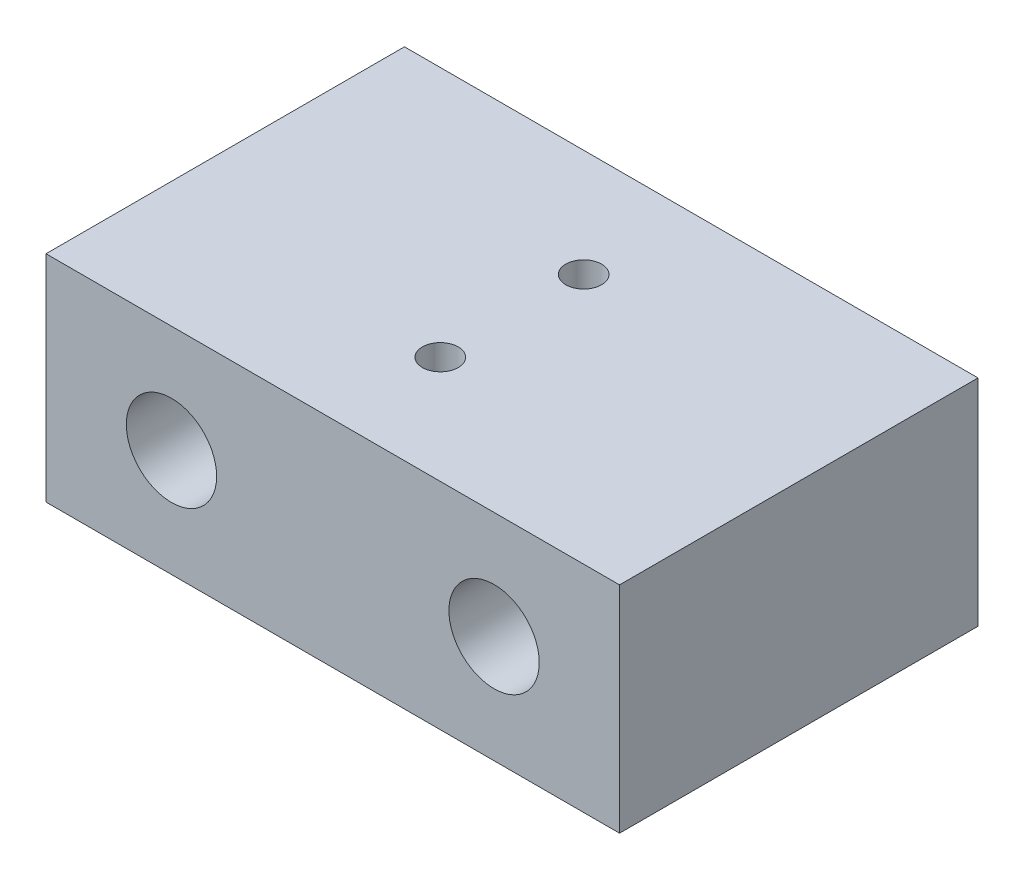
from build123d import *

# Parameters (mm, degrees)
SKETCH1_W           = 50.8
SKETCH1_H           = 19.05
SKETCH1_R           = 4
BOSS_EXTRUDE1_DEPTH = 31.75
SKETCH2_R           = 1.5875
CUT_EXTRUDE1_DEPTH  = 45.901280605


with BuildPart() as part:
    # Sketch1 → Boss-Extrude1 (new body)
    with BuildSketch(Plane.XY):
        Rectangle(SKETCH1_W, SKETCH1_H)
        with Locations((-14.2875, 0)):
            Circle(SKETCH1_R, mode=Mode.SUBTRACT)
        with Locations((14.2875, 0)):
            Circle(SKETCH1_R, mode=Mode.SUBTRACT)
    extrude(amount=BOSS_EXTRUDE1_DEPTH)

    # Sketch2 → Cut-Extrude1 (cut, through all)
    with BuildSketch(Plane(origin=(0, 9.525, 0), x_dir=(1, 0, 0), z_dir=(0, 1, 0))):
        with Locations((0, -9.525)):
            Circle(SKETCH2_R)
        with Locations((0, -22.225)):
            Circle(SKETCH2_R)
    extrude(amount=-CUT_EXTRUDE1_DEPTH, mode=Mode.SUBTRACT)


solid = part.part
